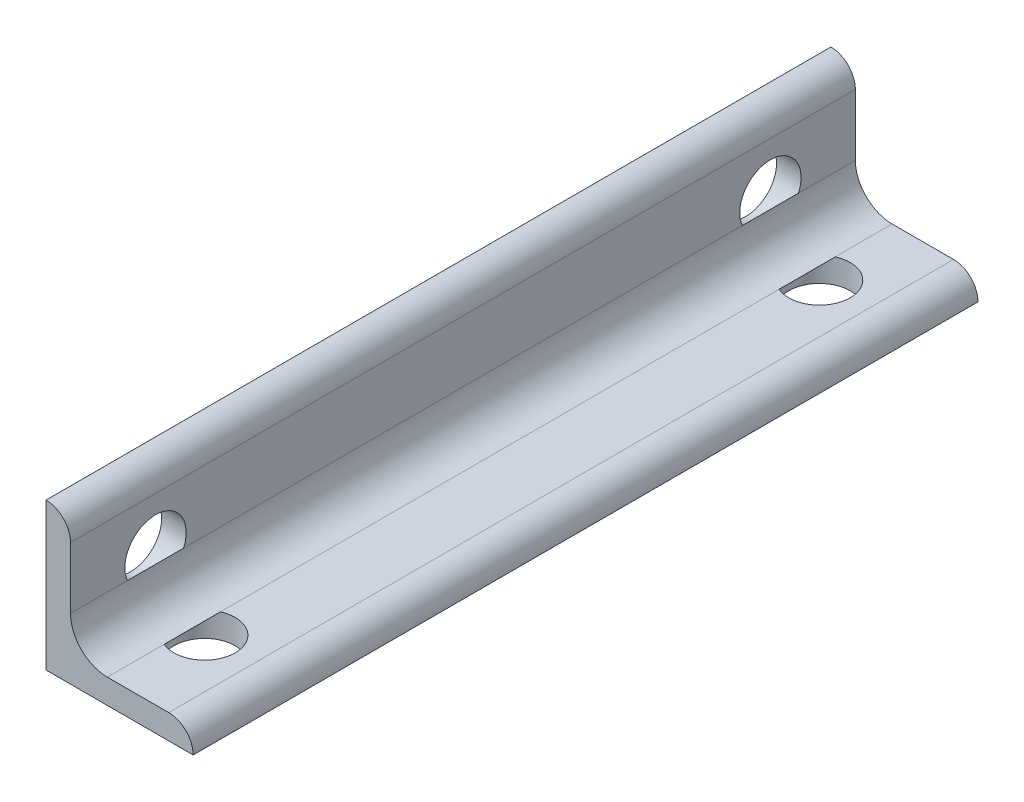
from build123d import *

# Parameters (mm, degrees)
BASESTEELANGLE_DEPTH = 50.8


with BuildPart() as part:
    # Sketch1 → BaseSteelAngle (new, symmetric)
    with BuildSketch(Plane.XY):
        with BuildLine():
            Line((0, 0), (0, 19.05))
            Line((0, 19.05), (0.00508, 19.05))
            ThreePointArc((0.00508, 19.05), (2.246551928, 18.121551928), (3.175, 15.88008))
            Line((3.175, 15.88008), (3.175, 7.9375))
            ThreePointArc((3.175, 7.9375), (4.569903955, 4.569903955), (7.9375, 3.175))
            Line((7.9375, 3.175), (15.88008, 3.175))
            ThreePointArc((15.88008, 3.175), (18.121551928, 2.246551928), (19.05, 0.00508))
            Line((19.05, 0.00508), (19.05, 0))
            Line((19.05, 0), (0, 0))
        make_face()
    extrude(amount=BASESTEELANGLE_DEPTH, both=True)

    # Sketch4 → 5/16 (0.3125) Diameter Hole2 (revolve, cut)
    with BuildSketch(Plane(origin=(9.525, 3.175, 39.8), x_dir=(0, 0, 1), z_dir=(1, 0, 0))):
        Polygon((0, 0), (0, 21.434665582), (3.96875, 19.05), (3.96875, 0), align=None)
    f_5_16_0_3125_diameter_hole2 = revolve(axis=Axis((9.525, 9.525, 39.8), (0, -1, 0)), mode=Mode.SUBTRACT)

    # Mirror1: 5/16 (0.3125) Diameter Hole2 across plane
    add(f_5_16_0_3125_diameter_hole2.mirror(Plane.XY), mode=Mode.SUBTRACT)

    # Sketch6 → 5/16 (0.3125) Diameter Hole3 (revolve, cut)
    with BuildSketch(Plane(origin=(3.175, 9.525, 39.8), x_dir=(0, 0, -1), z_dir=(0, 1, 0))):
        Polygon((0, 0), (0, 21.434665582), (3.96875, 19.05), (3.96875, 0), align=None)
    f_5_16_0_3125_diameter_hole3 = revolve(axis=Axis((9.525, 9.525, 39.8), (-1, 0, 0)), mode=Mode.SUBTRACT)

    # Mirror2: 5/16 (0.3125) Diameter Hole3 across plane
    add(f_5_16_0_3125_diameter_hole3.mirror(Plane.XY), mode=Mode.SUBTRACT)


solid = part.part
